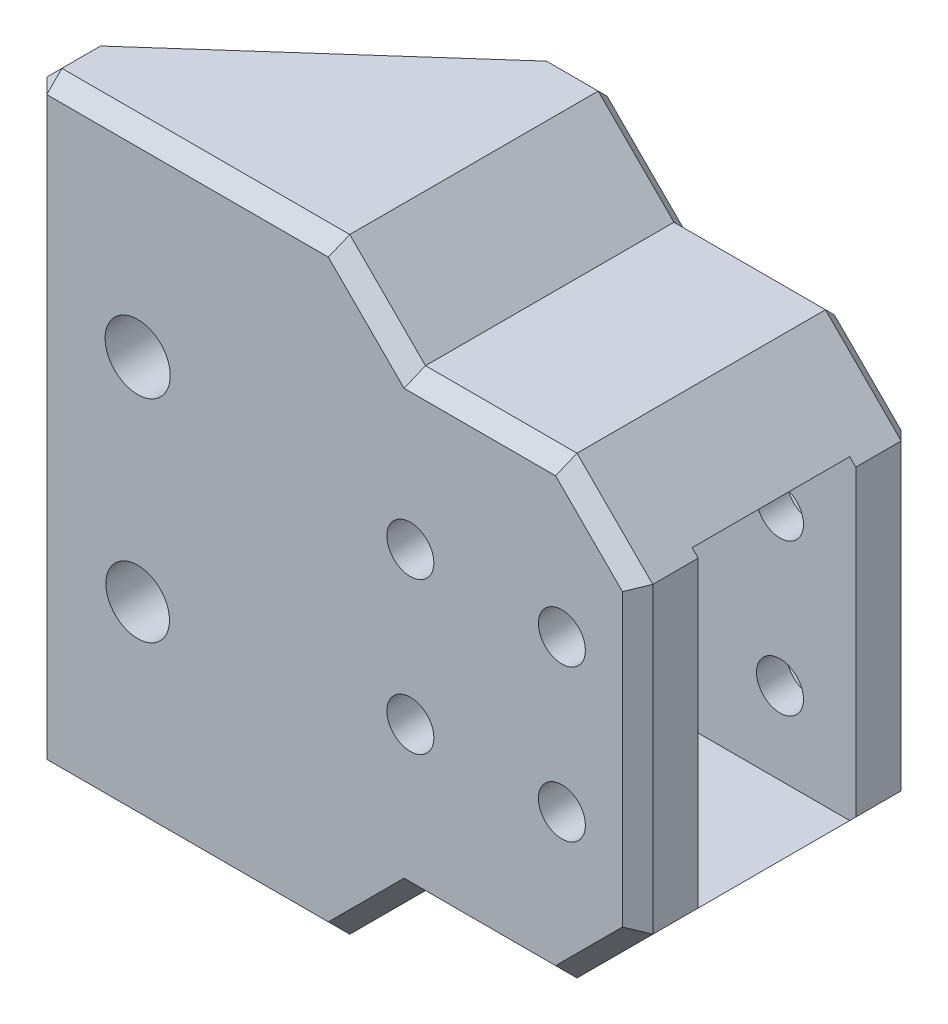
from build123d import *

# Parameters (mm, degrees)
SKETCH_1_W          = 40
SKETCH_1_H          = 30
SKETCH_1_R          = 2.15
SKETCH_1_R_2        = 2.1
SKETCH_1_R_3        = 1.55
EXTRUDE_1_DEPTH     = 4
CHAMFER_1_SIZE      = 5
EXTRUDE_2_DEPTH     = 10.4
EXTRUDE_START       = 4
SKETCH_4_R          = 1.55
EXTRUDE_3_DEPTH     = 4
EXTRUDE_4_DEPTH     = 5
EXTRUDE_5_DEPTH     = 5
CHAMFER_3_SIZE      = 10
CHAMFER_4_SIZE      = 1
CUT_EXTRUDE_1_DEPTH = 2
SKETCH_10_W         = 10.4
SKETCH_10_H         = 20.8
CUT_EXTRUDE_2_DEPTH = 43.806074335


with BuildPart() as part:
    # 草图1 → 凸台-拉伸1 (new body)
    with BuildSketch(Plane.XY):
        with Locations((20, 15)):
            Rectangle(SKETCH_1_W, SKETCH_1_H)
        with Locations((7, 22)):
            Circle(SKETCH_1_R, mode=Mode.SUBTRACT)
        with Locations((7, 8)):
            Circle(SKETCH_1_R_2, mode=Mode.SUBTRACT)
        with Locations((35, 20)):
            Circle(SKETCH_1_R_3, mode=Mode.SUBTRACT)
        with Locations((25, 20)):
            Circle(SKETCH_1_R_3, mode=Mode.SUBTRACT)
        with Locations((25, 10)):
            Circle(SKETCH_1_R_3, mode=Mode.SUBTRACT)
        with Locations((35, 10)):
            Circle(SKETCH_1_R_3, mode=Mode.SUBTRACT)
    extrude(amount=EXTRUDE_1_DEPTH)

    # 倒角1
    chamfer_1_edges = [part.edges().sort_by_distance(p)[0] for p in [
        (40, 30, 2),
        (40, 0, 2),
    ]]
    chamfer(chamfer_1_edges, length=CHAMFER_1_SIZE)

    # 草图3 → 凸台-拉伸2 (add)
    with BuildSketch(Plane(origin=(0, 0, 0), x_dir=(-1, 0, 0), z_dir=(0, 0, -1))):
        Polygon((-40, 25), (-20, 25), (-20, 5), (-40, 5), (-35, 0), (-16.2, 0), (-16.2, 30), (-35, 30), align=None)
    extrude(amount=EXTRUDE_2_DEPTH)

    # 草图4 → 凸台-拉伸3 (add)
    with BuildSketch(Plane(origin=(0, 0, -10.4), x_dir=(-1, 0, 0), z_dir=(0, 0, -1)).offset(EXTRUDE_START)):
        Polygon((-40, 25), (-40, 5), (-35, 0), (-16.2, 0), (-16.2, 30), (-35, 30), align=None)
        with Locations(Location((-35, 20, 0), (0, 0, 180))):
            Circle(SKETCH_4_R, mode=Mode.SUBTRACT)
        with Locations(Location((-25, 20, 0), (0, 0, 180))):
            Circle(SKETCH_4_R, mode=Mode.SUBTRACT)
        with Locations(Location((-25, 10, 0), (0, 0, 180))):
            Circle(SKETCH_4_R, mode=Mode.SUBTRACT)
        with Locations(Location((-35, 10, 0), (0, 0, 180))):
            Circle(SKETCH_4_R, mode=Mode.SUBTRACT)
    extrude(amount=-EXTRUDE_3_DEPTH)

    # 草图7 → 凸台-拉伸4 (add)
    with BuildSketch(Plane.XZ):
        Polygon((0, 0), (16.2, -14.4), (30, -14.4), (30, 4), (0, 4), align=None)
    extrude(amount=EXTRUDE_4_DEPTH)

    # 草图8 → 凸台-拉伸5 (add)
    with BuildSketch(Plane(origin=(0, 30, 0), x_dir=(1, 0, 0), z_dir=(0, 1, 0))):
        Polygon((0, 0), (16.2, 14.4), (30, 14.4), (30, -4), (0, -4), align=None)
    extrude(amount=EXTRUDE_5_DEPTH)

    # 倒角3
    # the kernel refuses this chamfer: 10 mm, written as the material it takes off along each edge
    with BuildSketch(Plane(origin=(30, 35, -40.11682988), x_dir=(-0.9996219169112968, 0.027495876610586317, 0), z_dir=(0, 0, 1))) as chamfer_3_piece_1_section:
        Polygon((CHAMFER_3_SIZE * 0.999621916911, CHAMFER_3_SIZE * 0.0274958766106), (-CHAMFER_3_SIZE * 0.0274958766106, CHAMFER_3_SIZE * 0.999621916911), (0, 0), align=None)
    chamfer_3_piece_1 = extrude(amount=69.833659759, mode=Mode.PRIVATE)
    chamfer_3_piece_1 = split(chamfer_3_piece_1, bisect_by=Plane(origin=(26.065989159, 30, -5.2), z_dir=(0, 1, 0)), keep=Keep.TOP, mode=Mode.PRIVATE)
    add(chamfer_3_piece_1, mode=Mode.SUBTRACT)
    with BuildSketch(Plane(origin=(30, -5, -40.11682988), x_dir=(-0.9996219169112968, -0.027495876610586403, 0), z_dir=(0, 0, 1))) as chamfer_3_piece_2_section:
        Polygon((CHAMFER_3_SIZE * 0.999621916911, -CHAMFER_3_SIZE * 0.0274958766106), (-CHAMFER_3_SIZE * 0.0274958766106, -CHAMFER_3_SIZE * 0.999621916911), (0, 0), align=None)
    chamfer_3_piece_2 = extrude(amount=69.833659759, mode=Mode.PRIVATE)
    chamfer_3_piece_2 = split(chamfer_3_piece_2, bisect_by=Plane(origin=(26.065989159, 0, -5.2), z_dir=(0, -1, 0)), keep=Keep.TOP, mode=Mode.PRIVATE)
    add(chamfer_3_piece_2, mode=Mode.SUBTRACT)

    # 倒角4
    chamfer_4_edges = [part.edges().sort_by_distance(p)[0] for p in [
        (30, 0, 4),
        (8.1, 0, -7.2),
        (0, -5, 2),
        (8.1, -5, -7.2),
        (18.1, -5, -14.4),
        (30, 30, -14.4),
        (8.1, 30, -7.2),
        (8.1, 35, -7.2),
        (0, 35, 2),
        (10, 35, 4),
        (18.1, 35, -14.4),
        (22.5, -2.5, -14.4),
        (22.5, 32.5, -14.4),
        (10, -5, 4),
        (22.5, -2.5, 4),
        (22.5, 32.5, 4),
        (40, 15, 4),
        (30, 30, 4),
        (37.5, 27.5, 4),
        (37.5, 2.5, 4),
        (0, 15, 4),
        (37.5, 27.5, -14.4),
        (40, 15, -14.4),
        (37.5, 2.5, -14.4),
        (30, 0, -14.4),
    ]]
    chamfer(chamfer_4_edges, length=CHAMFER_4_SIZE)

    # 草图9 → 切除-拉伸1 (cut)
    with BuildSketch(Plane(origin=(0, 0, -14.4), x_dir=(-1, 0, 0), z_dir=(0, 0, -1))):
        Polygon((-35, 16.766838493), (-32.2, 18.383419246), (-32.2, 21.616580754), (-35, 23.233161507), (-37.8, 21.616580754), (-37.8, 18.383419246), align=None)
        Polygon((26.245937902, 18.719863705), (29.045937902, 20.336444458), (29.045937902, 23.569605966), (26.245937902, 25.186186719), (23.445937902, 23.569605966), (23.445937902, 20.336444458), align=None)
        Polygon((-35, 6.766838493), (-32.2, 8.383419246), (-32.2, 11.616580754), (-35, 13.233161507), (-37.8, 11.616580754), (-37.8, 8.383419246), align=None)
        Polygon((-25, 6.766838493), (-22.2, 8.383419246), (-22.2, 11.616580754), (-25, 13.233161507), (-27.8, 11.616580754), (-27.8, 8.383419246), align=None)
        Polygon((-25, 16.766838493), (-22.2, 18.383419246), (-22.2, 21.616580754), (-25, 23.233161507), (-27.8, 21.616580754), (-27.8, 18.383419246), align=None)
    extrude(amount=-CUT_EXTRUDE_1_DEPTH, mode=Mode.SUBTRACT)

    # 草图10 → 切除-拉伸2 (cut, through all)
    with BuildSketch(Plane(origin=(20, 0, 0), x_dir=(0, 0, -1), z_dir=(1, 0, 0))):
        with Locations((5.2, 15)):
            Rectangle(SKETCH_10_W, SKETCH_10_H)
    extrude(amount=CUT_EXTRUDE_2_DEPTH, mode=Mode.SUBTRACT)


solid = part.part
